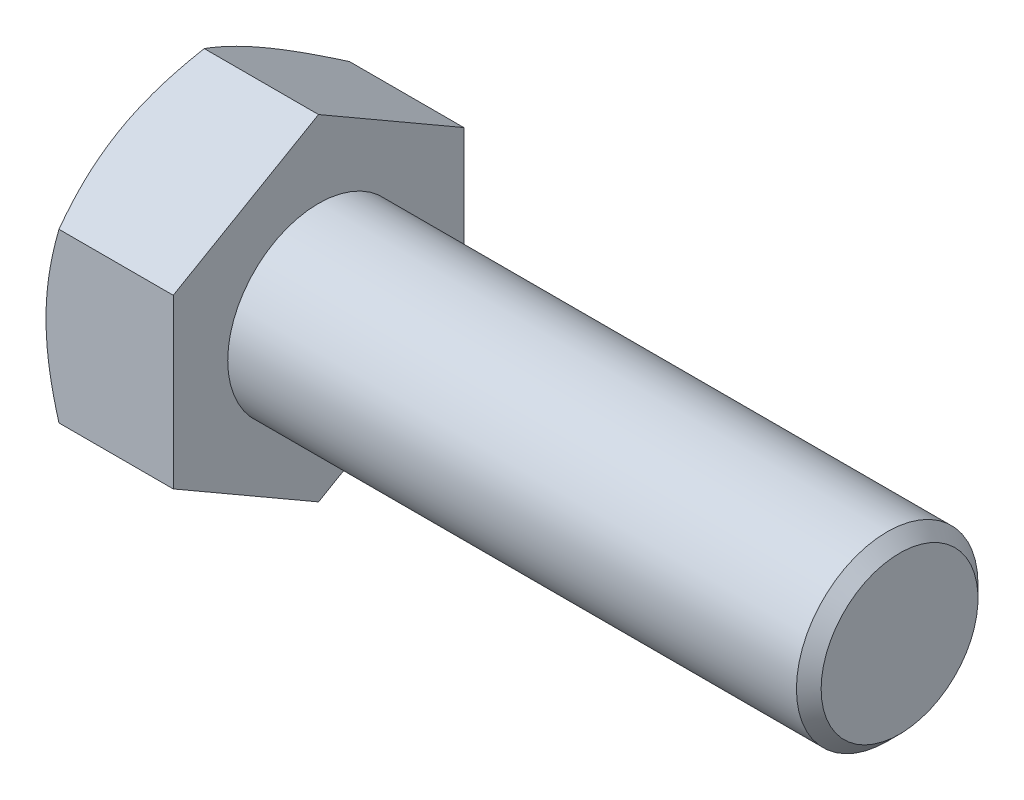
from build123d import *

# Parameters (mm, degrees)
BASEHEAD_DEPTH = 22.2504


with BuildPart() as part:
    # Sketch1 → BaseHead (new body)
    with BuildSketch(Plane(origin=(0, 0, 0), x_dir=(0, 0, -1), z_dir=(1, 0, 0))):
        Polygon((25.4, 14.664696837), (25.4, -14.664696837), (0, -29.329393675), (-25.4, -14.664696837), (-25.4, 14.664696837), (0, 29.329393675), align=None)
    extrude(amount=BASEHEAD_DEPTH)

    # BodySke → BaseBody (revolve)
    with BuildSketch(Plane.XY):
        Polygon((0, 0), (123.8504, 0), (123.8504, 13.71473), (121.69013, 15.875), (0, 15.875), align=None)
    revolve(axis=Axis((0, 0, 0), (1, 0, 0)))

    # Sketch3 → HeadChamfer (revolve, cut)
    with BuildSketch(Plane.XY):
        Polygon((0, 25.4), (5.934810705, 35.679393675), (5.934810705, 42.029393675), (-12.7, 42.029393675), (-12.7, 25.4), align=None)
    revolve(axis=Axis((0, 0, 0), (1, 0, 0)), mode=Mode.SUBTRACT)


solid = part.part
